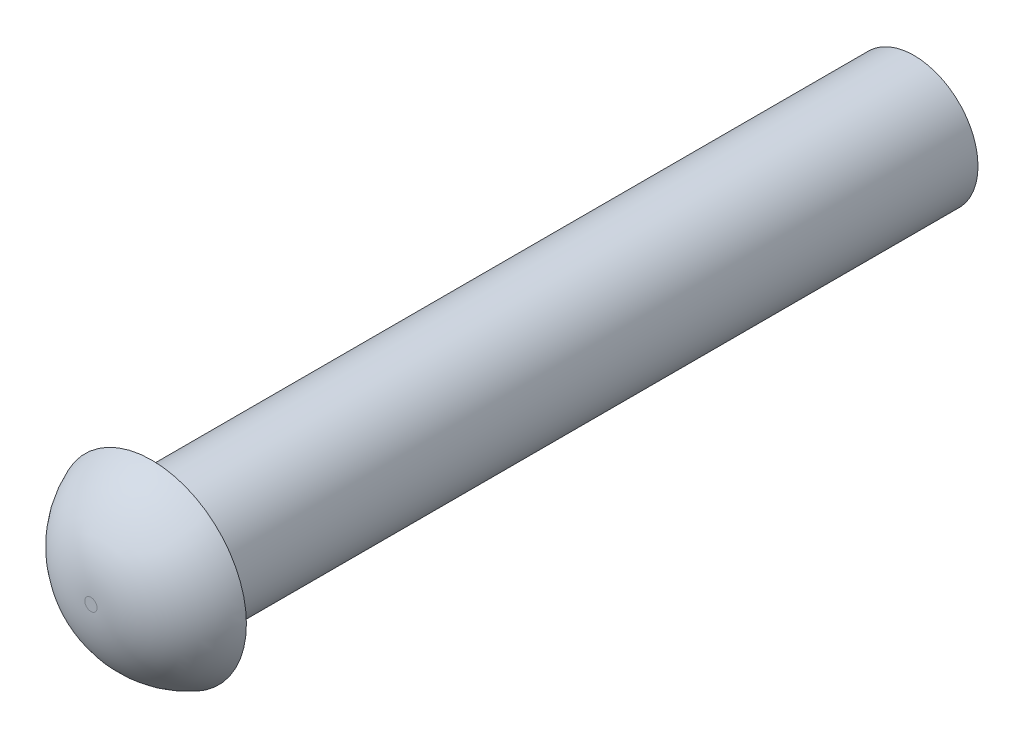
from build123d import *

# Parameters (mm, degrees)
DODANIE_WYCI_GNI_CIE1_DEPTH      = 6.5
DODANIE_WYCI_GNI_CIE1_DEPTH_BACK = 6
SZKIC1_R                         = 1.05
SZKIC2_R                         = 1.55
DODANIE_WYCI_GNI_CIE2_DEPTH      = 1
ZAOKR_GLENIE1_R                  = 1.55


with BuildPart() as part:
    # Szkic1 → Dodanie-wyciągnięcie1 (new, two sides: drawn at the far end of the back side and taken through both)
    with BuildSketch(Plane.XY.offset(-DODANIE_WYCI_GNI_CIE1_DEPTH_BACK)):
        Circle(SZKIC1_R)
    extrude(amount=DODANIE_WYCI_GNI_CIE1_DEPTH + DODANIE_WYCI_GNI_CIE1_DEPTH_BACK)

    # Szkic2 → Dodanie-wyciągnięcie2 (add)
    with BuildSketch(Plane.XY.offset(6.5)):
        Circle(SZKIC2_R)
    extrude(amount=DODANIE_WYCI_GNI_CIE2_DEPTH)

    # Zaokrąglenie1
    # the kernel refuses this fillet: 1.55 mm, written as the material it takes off along each edge
    with BuildSketch(Plane(origin=(0, 0, 7.5), x_dir=(1, 0, 0), z_dir=(0, -1, 0))) as zaokr_glenie1_piece_1:
        with BuildLine():
            CenterArc((0.100862325, -1.55), ZAOKR_GLENIE1_R, 20.783559596, 69.216440404)
            Line((0.100862325, 0), (0.100862325, 0.031))
            Line((0.100862325, 0.031), (1.55, 0.031))
            Line((1.55, 0.031), (1.581, 0))
            ThreePointArc((1.581, 0), (1.581, -0.5), (1.578982753, -0.989))
            Line((1.578982753, -0.989), (1.55, -1))
        make_face()
    revolve(axis=Axis((0, 0, 7.5), (0, 0, 1)), mode=Mode.SUBTRACT)


solid = part.part
